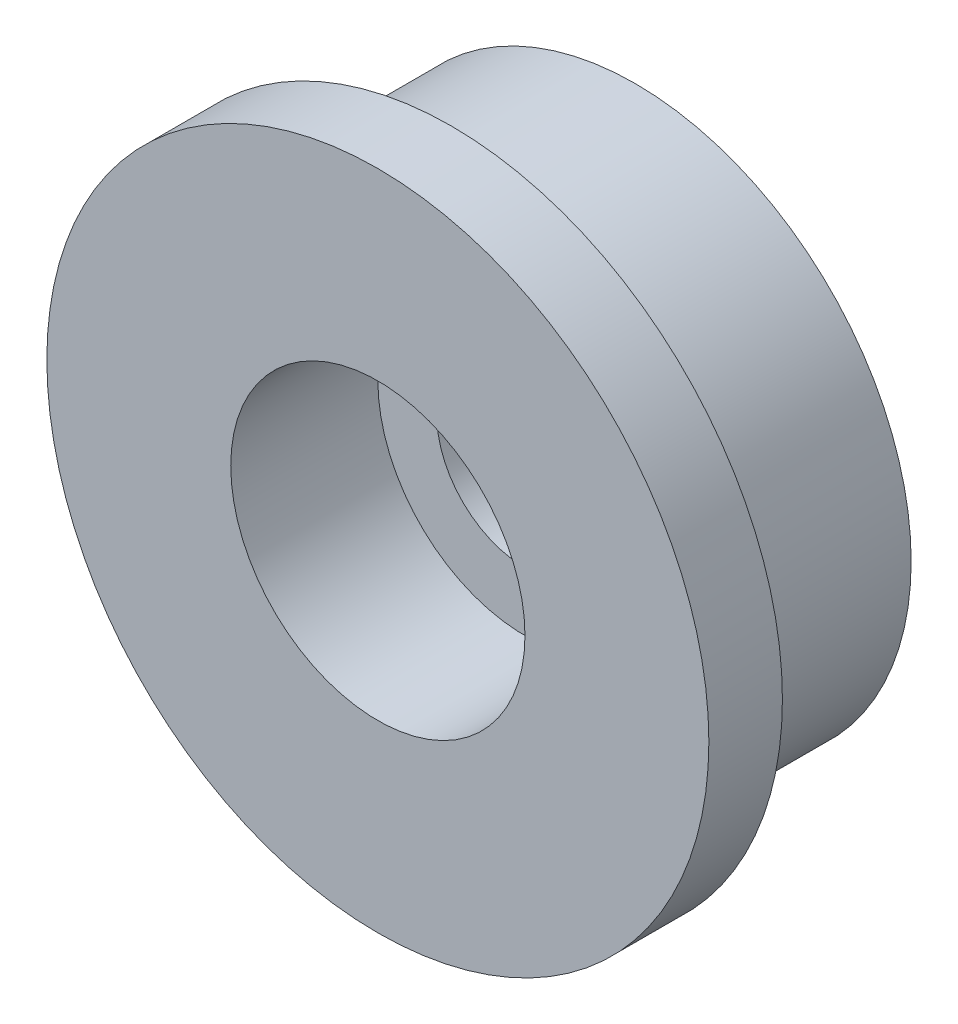
from build123d import *

# Parameters (mm, degrees)
SKETCH_1_R                   = 9
EXTRUDE_1_DEPTH              = 2
SKETCH_2_R                   = 7.5
EXTRUDE_2_DEPTH              = 5
HOLE_WIZARD_M4_2_D           = 4.8
HOLE_WIZARD_M4_2_CBORE_D     = 8
HOLE_WIZARD_M4_2_CBORE_DEPTH = 4
CUT_EXTRUDE_START            = -2
SKETCH_5_R                   = 4
CUT_EXTRUDE_3_DEPTH          = 2


with BuildPart() as part:
    # 草图1 → 凸台-拉伸1 (new body)
    with BuildSketch(Plane.XY):
        Circle(SKETCH_1_R)
    extrude(amount=EXTRUDE_1_DEPTH)

    # 草图2 → 凸台-拉伸2 (add)
    with BuildSketch(Plane.XY):
        Circle(SKETCH_2_R)
    extrude(amount=-EXTRUDE_2_DEPTH)

    # M4 六角凹头盖的柱孔2 (through all)
    with Locations(Plane.XY.offset(2)):
        with Locations((0, 0)):
            CounterBoreHole(HOLE_WIZARD_M4_2_D / 2, HOLE_WIZARD_M4_2_CBORE_D / 2, HOLE_WIZARD_M4_2_CBORE_DEPTH)

    # 草图5 → 切除-拉伸3 (cut)
    with BuildSketch(Plane(origin=(0, 0, -5), x_dir=(-1, 0, 0), z_dir=(0, 0, -1)).offset(CUT_EXTRUDE_START)):
        Circle(SKETCH_5_R)
    extrude(amount=CUT_EXTRUDE_3_DEPTH, mode=Mode.SUBTRACT)


solid = part.part
